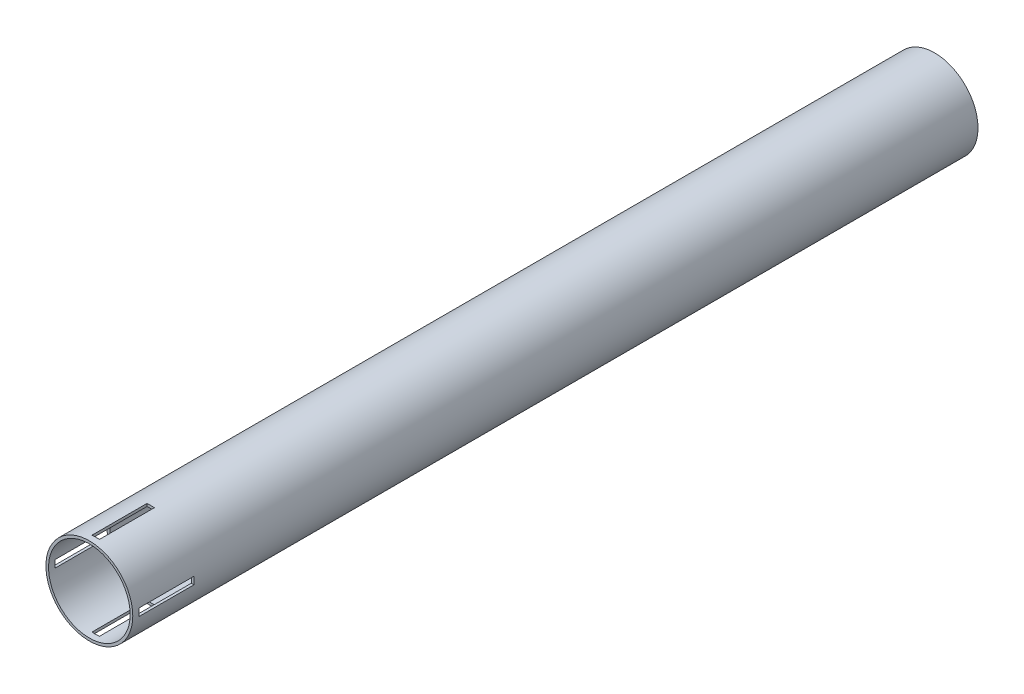
from build123d import *

# Parameters (mm, degrees)
SKETCH1_R           = 20.555
SKETCH1_R_2         = 19.305
BOSS_EXTRUDE3_DEPTH = 400
SKETCH2_W           = 3.5
SKETCH2_H           = 26
CUT_EXTRUDE1_DEPTH  = 402.0548791
CIRPATTERN1_COUNT   = 2
CIRPATTERN1_ANGLE   = 90


with BuildPart() as part:
    # Sketch1 → Boss-Extrude3 (new body)
    with BuildSketch(Plane.XY):
        Circle(SKETCH1_R)
        Circle(SKETCH1_R_2, mode=Mode.SUBTRACT)
    extrude(amount=-BOSS_EXTRUDE3_DEPTH)

    # Sketch2 → Cut-Extrude1 (cut, symmetric)
    with BuildSketch(Plane(origin=(0, 0, 0), x_dir=(1, 0, 0), z_dir=(0, 1, 0))):
        with Locations((0, 16)):
            Rectangle(SKETCH2_W, SKETCH2_H)
    cut_extrude1 = extrude(amount=CUT_EXTRUDE1_DEPTH, both=True, mode=Mode.SUBTRACT)

    # CirPattern1: Cut-Extrude1 ×2 about axis
    cirpattern1_axis = Axis((0, 0, -400), (0, 0, -1))
    for i in range(1, CIRPATTERN1_COUNT):
        add(cut_extrude1.rotate(cirpattern1_axis, i * CIRPATTERN1_ANGLE / (CIRPATTERN1_COUNT - 1)), mode=Mode.SUBTRACT)


solid = part.part
